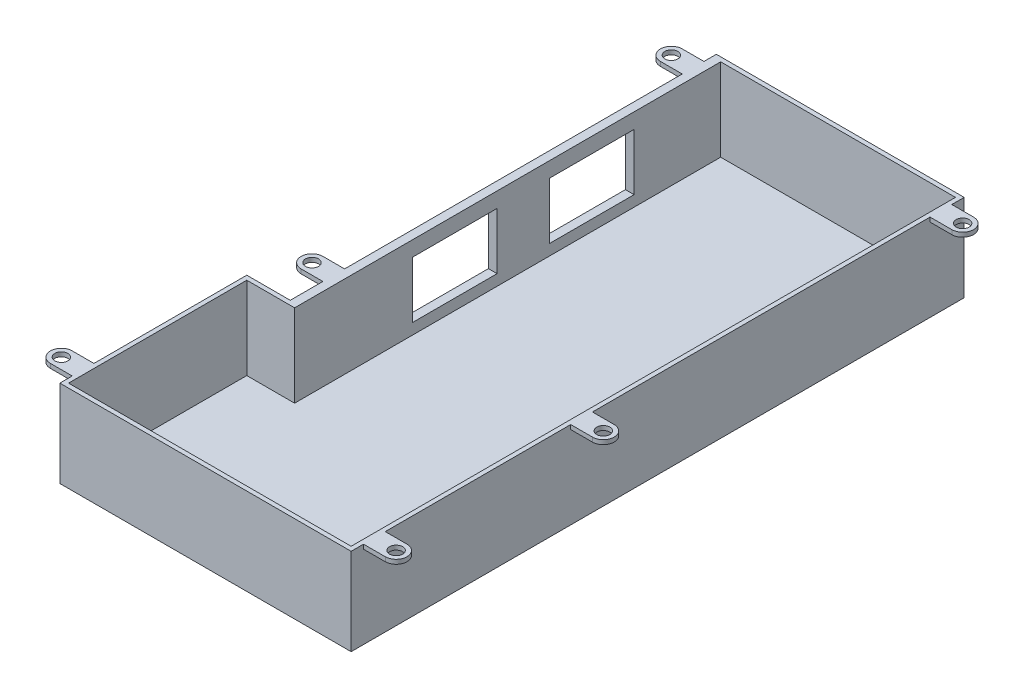
from build123d import *

# Parameters (mm, degrees)
SKETCH2_W               = 57
SKETCH2_H               = 141
BOSS_EXTRUDE1_DEPTH     = 20
SKETCH3_R               = 1.5
BOSS_EXTRUDE3_DEPTH     = 1
BOSS_EXTRUDE3_2_DEPTH   = 1
BOSS_EXTRUDE3_3_DEPTH   = 1
SKETCH4_W               = 43
SKETCH4_H               = 20
BOSS_EXTRUDE4_DEPTH     = 10
MIRROR1_START           = 19
MIRROR1_OUTLINE_R       = 1.5
MIRROR1_DEPTH           = 1
SHELL3_START            = -27.5
SHELL3_OUTLINE_W        = 19
SHELL3_OUTLINE_H        = 139
SHELL3_DEPTH            = 55
SHELL3_START_2          = 27.5
SHELL3_2_OUTLINE_W      = 19
SHELL3_2_OUTLINE_H      = 41
SHELL3_2_DEPTH          = 10
SKETCH10_R              = 1.5
BOSS_EXTRUDE5_DEPTH     = 1
MIRROR2_OUTLINE_W       = 1
MIRROR2_OUTLINE_H       = 41
MIRROR2_DEPTH           = 20
MIRROR2_2_DEPTH         = 1
MIRROR2_START           = 19
MIRROR2_3_OUTLINE_R     = 1.5
MIRROR2_3_DEPTH         = 1
SKETCH17_W              = 98
SKETCH17_H              = 20
BOSS_EXTRUDE7_DEPTH     = 2
CUT_EXTRUDE1_DEPTH      = 87.297450716
CUT_EXTRUDE1_DEPTH_BACK = 87.297450716
SKETCH11_W              = 45.81490068
SKETCH11_H              = 58.670112651
SKETCH13_W              = 18.731668524
SKETCH13_H              = 41
CUT_EXTRUDE15_DEPTH     = 87.297450716
SKETCH14_W              = 19.5
SKETCH14_H              = 13
CUT_EXTRUDE16_DEPTH     = 2
SKETCH15_R              = 1.5
BOSS_EXTRUDE6_DEPTH     = 1
SKETCH18_W              = 1
SKETCH18_H              = 19
BOSS_EXTRUDE8_DEPTH     = 1


# Read off the part's stored shape, not the designer's step: Mirror1, Shell3, Mirror2
with BuildPart() as part:
    # Sketch2 → Boss-Extrude1 (new body)
    with BuildSketch(Plane(origin=(0, 0, 0), x_dir=(1, 0, 0), z_dir=(0, 1, 0))):
        Rectangle(SKETCH2_W, SKETCH2_H)
    extrude(amount=BOSS_EXTRUDE1_DEPTH)

    # Sketch4 → Boss-Extrude4 (add)
    with BuildSketch(Plane(origin=(28.5, 0, 0), x_dir=(0, 0, -1), z_dir=(1, 0, 0))):
        with Locations((-49, 10)):
            Rectangle(SKETCH4_W, SKETCH4_H)
    extrude(amount=BOSS_EXTRUDE4_DEPTH)

    # Mirror1 outline → Mirror1 (add)
    with BuildSketch(Plane(origin=(0, 0, 0), x_dir=(1, 0, 0), z_dir=(0, 1, 0)).offset(MIRROR1_START)):
        with BuildLine():
            ThreePointArc((43.5, -67.652604127), (46, -65.152604127), (43.5, -62.652604127))
            Line((43.5, -62.652604127), (38.5, -62.652604127))
            Line((38.5, -62.652604127), (38.5, -67.652604127))
            Line((38.5, -67.652604127), (43.5, -67.652604127))
        make_face()
        with Locations((43.5, -65.152604127)):
            Circle(MIRROR1_OUTLINE_R, mode=Mode.SUBTRACT)
    extrude(amount=MIRROR1_DEPTH)

    # Shell3 outline → Shell3 (cut)
    with BuildSketch(Plane.YZ.offset(SHELL3_START)):
        with Locations((10.5, 0)):
            Rectangle(SHELL3_OUTLINE_W, SHELL3_OUTLINE_H)
    extrude(amount=SHELL3_DEPTH, mode=Mode.SUBTRACT)

    # Shell3 2 outline → Shell3 2 (cut)
    with BuildSketch(Plane.YZ.offset(SHELL3_START_2)):
        with Locations((10.5, 49)):
            Rectangle(SHELL3_2_OUTLINE_W, SHELL3_2_OUTLINE_H)
    extrude(amount=SHELL3_2_DEPTH, mode=Mode.SUBTRACT)

    # Sketch10 → Boss-Extrude5 (add)
    with BuildSketch(Plane(origin=(0, 20, 0), x_dir=(1, 0, 0), z_dir=(0, 1, 0))):
        with BuildLine():
            Line((33.5, -15), (28.5, -15))
            Line((28.5, -15), (28.5, -20))
            Line((28.5, -20), (33.5, -20))
            ThreePointArc((33.5, -20), (36, -17.5), (33.5, -15))
        make_face()
        with Locations(Location((33.5, -17.5, 0), (0, 0, 270))):
            Circle(SKETCH10_R, mode=Mode.SUBTRACT)
    extrude(amount=-BOSS_EXTRUDE5_DEPTH)


with BuildPart() as body_2:
    # Sketch3 → Boss-Extrude3 (new body)
    with BuildSketch(Plane(origin=(0, 20, 0), x_dir=(1, 0, 0), z_dir=(0, 1, 0))):
        with BuildLine():
            Line((-33.5, 67.652604127), (-28.5, 67.652604127))
            Line((-28.5, 67.652604127), (-28.5, 62.652604127))
            Line((-28.5, 62.652604127), (-33.5, 62.652604127))
            ThreePointArc((-33.5, 62.652604127), (-36, 65.152604127), (-33.5, 67.652604127))
        make_face()
        with Locations(Location((-33.5, 65.152604127, 0), (0, 0, 270))):
            Circle(SKETCH3_R, mode=Mode.SUBTRACT)
    extrude(amount=-BOSS_EXTRUDE3_DEPTH)



with BuildPart() as body_3:
    # Sketch3 → Boss-Extrude3 2 (new body)
    with BuildSketch(Plane(origin=(0, 20, 0), x_dir=(1, 0, 0), z_dir=(0, 1, 0))):
        with BuildLine():
            Line((-28.5, -67.652604127), (-28.5, -62.652604127))
            Line((-28.5, -62.652604127), (-33.5, -62.652604127))
            ThreePointArc((-33.5, -62.652604127), (-36, -65.152604127), (-33.5, -67.652604127))
            Line((-33.5, -67.652604127), (-28.5, -67.652604127))
        make_face()
        with Locations(Location((-33.5, -65.152604127, 0), (0, 0, 90))):
            Circle(SKETCH3_R, mode=Mode.SUBTRACT)
    extrude(amount=-BOSS_EXTRUDE3_2_DEPTH)


with BuildPart() as body_4:
    # Sketch3 → Boss-Extrude3 3 (new body)
    with BuildSketch(Plane(origin=(0, 20, 0), x_dir=(1, 0, 0), z_dir=(0, 1, 0))):
        with BuildLine():
            Line((28.5, 67.652604127), (28.5, 62.652604127))
            Line((28.5, 62.652604127), (33.5, 62.652604127))
            ThreePointArc((33.5, 62.652604127), (36, 65.152604127), (33.5, 67.652604127))
            Line((33.5, 67.652604127), (28.5, 67.652604127))
        make_face()
        with Locations(Location((33.5, 65.152604127, 0), (0, 0, 90))):
            Circle(SKETCH3_R, mode=Mode.SUBTRACT)
    extrude(amount=-BOSS_EXTRUDE3_3_DEPTH)


with BuildPart() as body_2_1:
    add(body_2.part)

    add(body_4.part)  # Mirror2 merges body 4

    add(part.part)  # Mirror2 merges part
    # Mirror2 outline → Mirror2 (add)
    with BuildSketch(Plane(origin=(0, 0, 0), x_dir=(1, 0, 0), z_dir=(0, 1, 0))):
        with Locations((28, -49)):
            Rectangle(MIRROR2_OUTLINE_W, MIRROR2_OUTLINE_H)
        Polygon((-28.5, -70.5), (-28.5, -69.5), (-37.5, -69.5), (-37.5, -28.5), (-28.5, -28.5), (-28.5, -27.5), (-38.5, -27.5), (-38.5, -70.5), align=None)
    extrude(amount=MIRROR2_DEPTH)

    # Mirror2 2 outline → Mirror2 2 (add)
    with BuildSketch(Plane(origin=(0, 0, 0), x_dir=(1, 0, 0), z_dir=(0, 1, 0))):
        Polygon((-37.5, -69.5), (-28.5, -69.5), (-28.5, -67.652604127), (-28.5, -62.652604127), (-28.5, -28.5), (-37.5, -28.5), align=None)
    extrude(amount=MIRROR2_2_DEPTH)

    # Mirror2 3 outline → Mirror2 3 (add)
    # profile 1 of 2: a face of its own
    with BuildSketch(Plane(origin=(0, 0, 0), x_dir=(1, 0, 0), z_dir=(0, 1, 0)).offset(MIRROR2_START)):
        with BuildLine():
            Line((-33.5, -20), (-28.5, -20))
            Line((-28.5, -20), (-28.5, -15))
            Line((-28.5, -15), (-33.5, -15))
            ThreePointArc((-33.5, -15), (-36, -17.5), (-33.5, -20))
        make_face()
        with Locations((-33.5, -17.5)):
            Circle(MIRROR2_3_OUTLINE_R, mode=Mode.SUBTRACT)
    # profile 2 of 2: a face of its own
    with BuildSketch(Plane(origin=(0, 0, 0), x_dir=(1, 0, 0), z_dir=(0, 1, 0)).offset(MIRROR2_START)):
        with BuildLine():
            Line((-43.5, -67.652604127), (-38.5, -67.652604127))
            Line((-38.5, -67.652604127), (-38.5, -62.652604127))
            Line((-38.5, -62.652604127), (-43.5, -62.652604127))
            ThreePointArc((-43.5, -62.652604127), (-46, -65.152604127), (-43.5, -67.652604127))
        make_face()
        with Locations((-43.5, -65.152604127)):
            Circle(MIRROR2_3_OUTLINE_R, mode=Mode.SUBTRACT)
    extrude(amount=MIRROR2_3_DEPTH)

    # Sketch17 → Boss-Extrude7 (add)
    with BuildSketch(Plane.ZY.offset(28.5)):
        with Locations((-21.5, 10)):
            Rectangle(SKETCH17_W, SKETCH17_H)
    extrude(amount=-BOSS_EXTRUDE7_DEPTH)

    # Sketch11 → Cut-Extrude1 (cut, two sides: drawn at the far end of the back side and taken through both)
    with BuildSketch(Plane(origin=(0, 1, 0), x_dir=(1, 0, 0), z_dir=(0, 1, 0)).offset(-CUT_EXTRUDE1_DEPTH_BACK)):
        with Locations((51.40745034, -56.835056326)):
            Rectangle(SKETCH11_W, SKETCH11_H)
    extrude(amount=CUT_EXTRUDE1_DEPTH + CUT_EXTRUDE1_DEPTH_BACK, mode=Mode.SUBTRACT)


with BuildPart() as cut_extrude15_tool:
    # Sketch13 → Cut-Extrude15 (new, through all)
    with BuildSketch(Plane(origin=(0, 1, 0), x_dir=(1, 0, 0), z_dir=(0, 1, 0))):
        with Locations((-28.134165738, -49)):
            Rectangle(SKETCH13_W, SKETCH13_H)
    extrude(amount=CUT_EXTRUDE15_DEPTH)


with BuildPart() as body_2_2:
    add(body_2_1.part)

    # Cut-Extrude15: cut by cut_extrude15_tool
    add(cut_extrude15_tool.part, mode=Mode.SUBTRACT)

    # Sketch14 → Cut-Extrude16 (cut)
    with BuildSketch(Plane.ZY.offset(28.5)):
        with Locations((-39.826302064, 10)):
            Rectangle(SKETCH14_W, SKETCH14_H)
        with Locations((-8.326302064, 10.017547542)):
            Rectangle(SKETCH14_W, SKETCH14_H)
    extrude(amount=-CUT_EXTRUDE16_DEPTH, mode=Mode.SUBTRACT)

    # Sketch15 → Boss-Extrude6 (add)
    with BuildSketch(Plane(origin=(0, 20, 0), x_dir=(1, 0, 0), z_dir=(0, 1, 0))):
        with BuildLine():
            Line((28.5, -67.652604127), (33.5, -67.652604127))
            ThreePointArc((33.5, -67.652604127), (36, -65.152604127), (33.5, -62.652604127))
            Line((33.5, -62.652604127), (28.5, -62.652604127))
            Line((28.5, -62.652604127), (28.5, -67.652604127))
        make_face()
        with Locations(Location((33.5, -65.152604127, 0), (0, 0, 90))):
            Circle(SKETCH15_R, mode=Mode.SUBTRACT)
    extrude(amount=-BOSS_EXTRUDE6_DEPTH)

    # Sketch18 → Boss-Extrude8 (add)
    with BuildSketch(Plane(origin=(-27.5, 0, 0), x_dir=(0, 0, -1), z_dir=(1, 0, 0))):
        with Locations((-28, 10.5)):
            Rectangle(SKETCH18_W, SKETCH18_H)
    extrude(amount=BOSS_EXTRUDE8_DEPTH)


with BuildPart() as body_3_1:
    add(body_3.part)

    # Cut-Extrude15: cut by cut_extrude15_tool
    add(cut_extrude15_tool.part, mode=Mode.SUBTRACT)


solid = body_2_2.part
